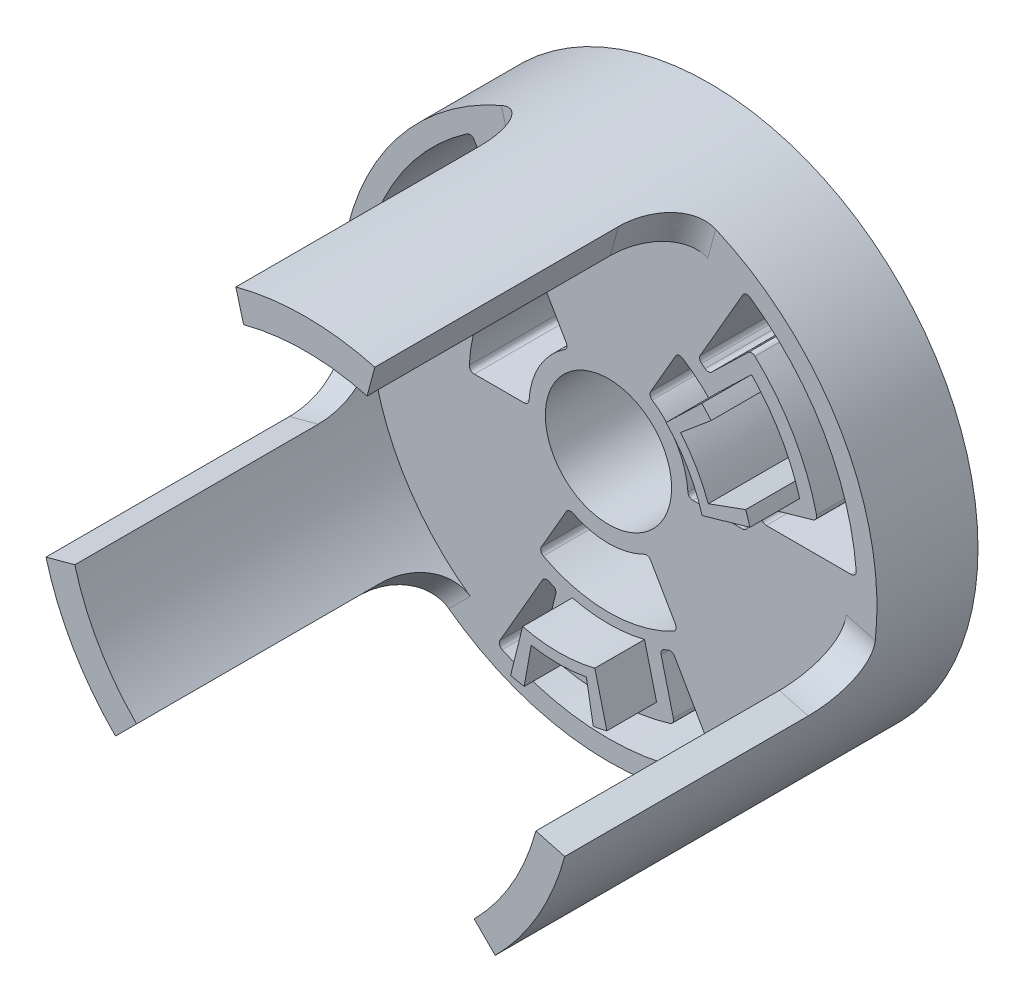
from build123d import *
from build123d.topology import SkipClean

# Parameters (mm, degrees)
SKETCH1_R                = 13.5
BOSS_EXTRUDE1_DEPTH      = 5.08
SKETCH2_R                = 3.175
CUT_EXTRUDE1_DEPTH       = 5.08
CUT_EXTRUDE2_DEPTH       = 5.08
BOSS_EXTRUDE3_DEPTH      = 15.24
BOSS_EXTRUDE4_DEPTH      = 2.5
CUT_EXTRUDE3_REACH       = 26.429
FILLET3_SIZE             = 2
FILLET3_SIZE_2           = 3
CUT_EXTRUDE4_REACH       = 26.429
FILLET4_R                = 0.25
CIRPATTERN1_COUNT        = 3
FILLET4_OF_CIRPATTERN1_R = 0.25


with BuildPart() as part:
    # Sketch1 → Boss-Extrude1 (new body)
    with BuildSketch(Plane.XY):
        Circle(SKETCH1_R)
    extrude(amount=BOSS_EXTRUDE1_DEPTH)

    # Sketch2 → Cut-Extrude1 (cut)
    with BuildSketch(Plane.XY.offset(5.08)):
        Circle(SKETCH2_R)
    extrude(amount=-CUT_EXTRUDE1_DEPTH, mode=Mode.SUBTRACT)

    # Sketch3 → Cut-Extrude2 (cut)
    with BuildSketch(Plane.XY.offset(5.08)):
        with BuildLine():
            ThreePointArc((-4, 0), (-3.464101615, 2), (-2, 3.464101615))
            Line((-2, 3.464101615), (-3.5, 6.062177826))
            ThreePointArc((-3.5, 6.062177826), (-6.062177826, 3.5), (-7, 0))
            Line((-7, 0), (-4, 0))
        make_face()
        with BuildLine():
            Line((3.5, 6.062177826), (2, 3.464101615))
            ThreePointArc((2, 3.464101615), (3.464101615, 2), (4, 0))
            Line((4, 0), (7, 0))
            ThreePointArc((7, 0), (6.062177826, 3.5), (3.5, 6.062177826))
        make_face()
        with BuildLine():
            ThreePointArc((2, -3.464101615), (0, -4), (-2, -3.464101615))
            Line((-2, -3.464101615), (-3.5, -6.062177826))
            ThreePointArc((-3.5, -6.062177826), (0, -7), (3.5, -6.062177826))
            Line((3.5, -6.062177826), (2, -3.464101615))
        make_face()
    extrude(amount=-CUT_EXTRUDE2_DEPTH, mode=Mode.SUBTRACT)

    # Sketch5 → Boss-Extrude3 (add)
    with SkipClean():  # the faces are left unmerged after this step: merging them gives an invalid solid
        with BuildSketch(Plane.XY.offset(5.08)):
            with BuildLine():
                Line((8.485281374, -8.485281374), (9.545941546, -9.545941546))
                ThreePointArc((9.545941546, -9.545941546), (11.691342951, -6.75), (13.039998655, -3.494057109))
                Line((13.039998655, -3.494057109), (11.591109915, -3.105828541))
                ThreePointArc((11.591109915, -3.105828541), (10.392304845, -6), (8.485281374, -8.485281374))
            make_face()
            with BuildLine():
                Line((-8.485281374, -8.485281374), (-9.545941546, -9.545941546))
                ThreePointArc((-9.545941546, -9.545941546), (-11.691342951, -6.75), (-13.039998655, -3.494057109))
                Line((-13.039998655, -3.494057109), (-11.591109915, -3.105828541))
                ThreePointArc((-11.591109915, -3.105828541), (-10.392304845, -6), (-8.485281374, -8.485281374))
            make_face()
            with BuildLine():
                Line((-3.105828541, 11.591109915), (-3.494057109, 13.039998655))
                ThreePointArc((-3.494057109, 13.039998655), (0, 13.5), (3.494057109, 13.039998655))
                Line((3.494057109, 13.039998655), (3.105828541, 11.591109915))
                ThreePointArc((3.105828541, 11.591109915), (0, 12), (-3.105828541, 11.591109915))
            make_face()
        extrude(amount=BOSS_EXTRUDE3_DEPTH)

    # Sketch8 → Boss-Extrude4 (add)
    with SkipClean():  # the faces are left unmerged after this step: merging them gives an invalid solid
        with BuildSketch(Plane.XY.offset(5.08)):
            with BuildLine():
                Line((5.754718403, 5.557266964), (7.193398003, 6.946583705))
                ThreePointArc((7.193398003, 6.946583705), (7.431448255, 6.691306064), (7.660444431, 6.427876097))
                Line((7.660444431, 6.427876097), (7.27742221, 6.106482292))
                Line((7.27742221, 6.106482292), (6.128355545, 5.142300877))
                ThreePointArc((6.128355545, 5.142300877), (6.92820323, 4), (7.517540966, 2.736161147))
                Line((7.517540966, 2.736161147), (8.927079897, 3.249191362))
                Line((8.927079897, 3.249191362), (9.396926208, 3.420201433))
                ThreePointArc((9.396926208, 3.420201433), (9.510565163, 3.090169944), (9.612616959, 2.756373558))
                Line((9.612616959, 2.756373558), (7.690093568, 2.205098847))
                Line((7.690093568, 2.205098847), (7.20946272, 2.067280169))
                ThreePointArc((7.20946272, 2.067280169), (6.495190528, 3.75), (5.395048503, 5.209937778))
                Line((5.395048503, 5.209937778), (5.754718403, 5.557266964))
            make_face()
            with BuildLine():
                Line((-7.27742221, 6.106482292), (-6.128355545, 5.142300877))
                ThreePointArc((-6.128355545, 5.142300877), (-6.92820323, 4), (-7.517540966, 2.736161147))
                Line((-7.517540966, 2.736161147), (-8.927079897, 3.249191362))
                Line((-8.927079897, 3.249191362), (-9.396926208, 3.420201433))
                ThreePointArc((-9.396926208, 3.420201433), (-9.510565163, 3.090169944), (-9.612616959, 2.756373558))
                Line((-9.612616959, 2.756373558), (-7.690093568, 2.205098847))
                Line((-7.690093568, 2.205098847), (-7.20946272, 2.067280169))
                ThreePointArc((-7.20946272, 2.067280169), (-6.495190528, 3.75), (-5.395048503, 5.209937778))
                Line((-5.395048503, 5.209937778), (-5.754718403, 5.557266964))
                Line((-5.754718403, 5.557266964), (-7.193398003, 6.946583705))
                ThreePointArc((-7.193398003, 6.946583705), (-7.431448255, 6.691306064), (-7.660444431, 6.427876097))
                Line((-7.660444431, 6.427876097), (-7.27742221, 6.106482292))
            make_face()
            with BuildLine():
                Line((-1.389185421, -7.878462024), (-1.649657688, -9.355673654))
                Line((-1.649657688, -9.355673654), (-1.736481777, -9.84807753))
                ThreePointArc((-1.736481777, -9.84807753), (-2.079116908, -9.781476007), (-2.419218956, -9.702957263))
                Line((-2.419218956, -9.702957263), (-1.935375165, -7.76236581))
                Line((-1.935375165, -7.76236581), (-1.814414217, -7.277217947))
                ThreePointArc((-1.814414217, -7.277217947), (0, -7.5), (1.814414217, -7.277217947))
                Line((1.814414217, -7.277217947), (1.935375165, -7.76236581))
                Line((1.935375165, -7.76236581), (2.419218956, -9.702957263))
                ThreePointArc((2.419218956, -9.702957263), (2.079116908, -9.781476007), (1.736481777, -9.84807753))
                Line((1.736481777, -9.84807753), (1.649657688, -9.355673654))
                Line((1.649657688, -9.355673654), (1.389185421, -7.878462024))
                ThreePointArc((1.389185421, -7.878462024), (0, -8), (-1.389185421, -7.878462024))
            make_face()
        extrude(amount=BOSS_EXTRUDE4_DEPTH)

    # Sketch9 → Cut-Extrude3 (cut, up to next)
    with BuildSketch(Plane.XY.offset(5.08), mode=Mode.PRIVATE) as cut_extrude3_sk1:
        with BuildLine():
            Line((1.389185421, -7.878462024), (1.736481777, -9.84807753))
            ThreePointArc((1.736481777, -9.84807753), (0, -10), (-1.736481777, -9.84807753))
            Line((-1.736481777, -9.84807753), (-1.389185421, -7.878462024))
            ThreePointArc((-1.389185421, -7.878462024), (0, -8), (1.389185421, -7.878462024))
        make_face()
    cut_extrude3_tool1 = extrude(cut_extrude3_sk1.sketch, amount=-CUT_EXTRUDE3_REACH, mode=Mode.PRIVATE) & part.part
    # Sketch9 → Cut-Extrude3 (cut, up to next)
    with BuildSketch(Plane.XY.offset(5.08), mode=Mode.PRIVATE) as cut_extrude3_sk2:
        with BuildLine():
            Line((9.396926208, 3.420201433), (7.517540966, 2.736161147))
            ThreePointArc((7.517540966, 2.736161147), (6.92820323, 4), (6.128355545, 5.142300877))
            Line((6.128355545, 5.142300877), (7.660444431, 6.427876097))
            ThreePointArc((7.660444431, 6.427876097), (8.660254038, 5), (9.396926208, 3.420201433))
        make_face()
    cut_extrude3_tool2 = extrude(cut_extrude3_sk2.sketch, amount=-CUT_EXTRUDE3_REACH, mode=Mode.PRIVATE) & part.part
    # Sketch9 → Cut-Extrude3 (cut, up to next)
    with BuildSketch(Plane.XY.offset(5.08), mode=Mode.PRIVATE) as cut_extrude3_sk3:
        with BuildLine():
            Line((-7.517540966, 2.736161147), (-9.396926208, 3.420201433))
            ThreePointArc((-9.396926208, 3.420201433), (-8.660254038, 5), (-7.660444431, 6.427876097))
            Line((-7.660444431, 6.427876097), (-6.128355545, 5.142300877))
            ThreePointArc((-6.128355545, 5.142300877), (-6.92820323, 4), (-7.517540966, 2.736161147))
        make_face()
    cut_extrude3_tool3 = extrude(cut_extrude3_sk3.sketch, amount=-CUT_EXTRUDE3_REACH, mode=Mode.PRIVATE) & part.part
    add(cut_extrude3_tool1.solids().sort_by_distance((0, -8.991226, 5.08))[0], mode=Mode.SUBTRACT)
    add(cut_extrude3_tool2.solids().sort_by_distance((7.78663, 4.495613, 5.08))[0], mode=Mode.SUBTRACT)
    add(cut_extrude3_tool3.solids().sort_by_distance((-7.78663, 4.495613, 5.08))[0], mode=Mode.SUBTRACT)

    # Fillet3
    # an asymmetric fillet: 3, 2 mm, written as the material it adds along each edge
    with BuildSketch(Plane(origin=(-20.284442352, -5.435199947, 5.08), x_dir=(-0.2588190451025188, 0.9659258262890689, 0), z_dir=(0.9659258262890689, 0.2588190451025188, 0))) as fillet3_piece_1_section:
        with BuildLine():
            Bezier((FILLET3_SIZE, 0), (0, 0), (0, FILLET3_SIZE_2), weights=[1, 0.707106781, 1])
            Line((0, FILLET3_SIZE_2), (0, 0))
            Line((0, 0), (FILLET3_SIZE, 0))
        make_face()
    fillet3_piece_1 = extrude(amount=16.5, mode=Mode.PRIVATE)
    fillet3_piece_1 = fillet3_piece_1 & Plane(origin=(0, 0, 5.749671488), x_dir=(1, 0, 0), z_dir=(0, 0, -1)) * Cylinder(13.5, 45, mode=Mode.PRIVATE)
    fillet3_piece_1 = fillet3_piece_1 - Plane(origin=(0, 0, 5.749671488), x_dir=(-0.9659258262890689, -0.25881904510251874, 0), z_dir=(0, 0, -1)) * Cylinder(12, 45, mode=Mode.PRIVATE)
    add(fillet3_piece_1)
    with BuildSketch(Plane(origin=(-3.181980515, -3.181980515, 5.08), x_dir=(0.707106781186547, -0.7071067811865482, 0), z_dir=(-0.7071067811865481, -0.7071067811865469, 0))) as fillet3_piece_2_section:
        with BuildLine():
            Bezier((FILLET3_SIZE, 0), (0, 0), (0, FILLET3_SIZE_2), weights=[1, 0.707106781, 1])
            Line((0, FILLET3_SIZE_2), (0, 0))
            Line((0, 0), (FILLET3_SIZE, 0))
        make_face()
    fillet3_piece_2 = extrude(amount=16.5, mode=Mode.PRIVATE)
    fillet3_piece_2 = fillet3_piece_2 & Plane(origin=(0, 0, 5.749671467), x_dir=(1, 0, 0), z_dir=(0, 0, -1)) * Cylinder(13.5, 46, mode=Mode.PRIVATE)
    fillet3_piece_2 = fillet3_piece_2 - Plane(origin=(0, 0, 5.749671467), x_dir=(-0.9659258262890689, -0.25881904510251874, 0), z_dir=(0, 0, -1)) * Cylinder(12, 46, mode=Mode.PRIVATE)
    add(fillet3_piece_2)
    with BuildSketch(Plane(origin=(3.181980515, -3.181980515, 5.08), x_dir=(-0.7071067811865481, -0.707106781186547, 0), z_dir=(0.707106781186547, -0.7071067811865481, 0))) as fillet3_piece_3_section:
        with BuildLine():
            Bezier((FILLET3_SIZE, 0), (0, 0), (0, -FILLET3_SIZE_2), weights=[1, 0.707106781, 1])
            Line((0, -FILLET3_SIZE_2), (0, 0))
            Line((0, 0), (FILLET3_SIZE, 0))
        make_face()
    fillet3_piece_3 = extrude(amount=16.5, mode=Mode.PRIVATE)
    fillet3_piece_3 = fillet3_piece_3 & Plane(origin=(0, 0, 5.749671497), x_dir=(1, 0, 0), z_dir=(0, 0, -1)) * Cylinder(13.5, 45, mode=Mode.PRIVATE)
    fillet3_piece_3 = fillet3_piece_3 - Plane(origin=(0, 0, 5.749671497), x_dir=(0.9659258262890674, -0.2588190451025241, 0), z_dir=(0, 0, -1)) * Cylinder(12, 45, mode=Mode.PRIVATE)
    add(fillet3_piece_3)
    with BuildSketch(Plane(origin=(20.284442352, -5.435199947, 5.08), x_dir=(0.2588190451025222, 0.965925826289068, 0), z_dir=(-0.965925826289068, 0.2588190451025222, 0))) as fillet3_piece_4_section:
        with BuildLine():
            Bezier((FILLET3_SIZE, 0), (0, 0), (0, -FILLET3_SIZE_2), weights=[1, 0.707106781, 1])
            Line((0, -FILLET3_SIZE_2), (0, 0))
            Line((0, 0), (FILLET3_SIZE, 0))
        make_face()
    fillet3_piece_4 = extrude(amount=16.5, mode=Mode.PRIVATE)
    fillet3_piece_4 = fillet3_piece_4 & Plane(origin=(0, 0, 5.749671462), x_dir=(1, 0, 0), z_dir=(0, 0, -1)) * Cylinder(13.5, 46, mode=Mode.PRIVATE)
    fillet3_piece_4 = fillet3_piece_4 - Plane(origin=(0, 0, 5.749671462), x_dir=(0.9659258262890674, -0.2588190451025241, 0), z_dir=(0, 0, -1)) * Cylinder(12, 46, mode=Mode.PRIVATE)
    add(fillet3_piece_4)
    with BuildSketch(Plane(origin=(5.435199947, 20.284442352, 5.08), x_dir=(0.9659258262890699, -0.2588190451025149, 0), z_dir=(-0.2588190451025149, -0.9659258262890699, 0))) as fillet3_piece_5_section:
        with BuildLine():
            Bezier((FILLET3_SIZE, 0), (0, 0), (0, FILLET3_SIZE_2), weights=[1, 0.707106781, 1])
            Line((0, FILLET3_SIZE_2), (0, 0))
            Line((0, 0), (FILLET3_SIZE, 0))
        make_face()
    fillet3_piece_5 = extrude(amount=16.5, mode=Mode.PRIVATE)
    fillet3_piece_5 = fillet3_piece_5 & Plane(origin=(0, 0, 5.749671489), x_dir=(1, 0, 0), z_dir=(0, 0, -1)) * Cylinder(13.5, 46, mode=Mode.PRIVATE)
    fillet3_piece_5 = fillet3_piece_5 - Plane(origin=(0, 0, 5.749671489), x_dir=(0.25881904510251574, 0.9659258262890696, 0), z_dir=(0, 0, -1)) * Cylinder(12, 46, mode=Mode.PRIVATE)
    add(fillet3_piece_5)
    with BuildSketch(Plane(origin=(-1.164685703, 4.346666218, 5.08), x_dir=(-0.9659258262890665, -0.2588190451025271, 0), z_dir=(-0.2588190451025271, 0.9659258262890666, 0))) as fillet3_piece_6_section:
        with BuildLine():
            Bezier((FILLET3_SIZE, 0), (0, 0), (0, FILLET3_SIZE_2), weights=[1, 0.707106781, 1])
            Line((0, FILLET3_SIZE_2), (0, 0))
            Line((0, 0), (FILLET3_SIZE, 0))
        make_face()
    fillet3_piece_6 = extrude(amount=16.5, mode=Mode.PRIVATE)
    fillet3_piece_6 = fillet3_piece_6 & Plane(origin=(0, 0, 5.749671467), x_dir=(1, 0, 0), z_dir=(0, 0, -1)) * Cylinder(13.5, 45, mode=Mode.PRIVATE)
    fillet3_piece_6 = fillet3_piece_6 - Plane(origin=(0, 0, 5.749671467), x_dir=(0.25881904510251574, 0.9659258262890696, 0), z_dir=(0, 0, -1)) * Cylinder(12, 45, mode=Mode.PRIVATE)
    add(fillet3_piece_6)

    # Sketch10 → Cut-Extrude4 (cut, up to next)
    with BuildSketch(Plane.XY.offset(5.08), mode=Mode.PRIVATE) as cut_extrude4_sk1:
        with BuildLine():
            Line((-4.506331208, 6.305194608), (-6.88825891, 10.430814407))
            ThreePointArc((-6.88825891, 10.430814407), (-10.825317547, 6.25), (-12.477479713, 0.75))
            Line((-12.477479713, 0.75), (-7.71362431, 0.75))
            ThreePointArc((-7.71362431, 0.75), (-7.674577533, 1.078591532), (-7.621539603, 1.405216737))
            Line((-7.621539603, 1.405216737), (-10.515111281, 2.234935064))
            ThreePointArc((-10.515111281, 2.234935064), (-10.333579521, 2.963044767), (-10.101695673, 3.676716541))
            ThreePointArc((-10.101695673, 3.676716541), (-9.309773091, 5.375), (-8.234977764, 6.909966804))
            ThreePointArc((-8.234977764, 6.909966804), (-7.732861801, 7.467619994), (-7.193066182, 7.988885961))
            Line((-7.193066182, 7.988885961), (-5.027723193, 5.897838544))
            ThreePointArc((-5.027723193, 5.897838544), (-4.771376434, 6.10708334), (-4.506331208, 6.305194608))
        make_face()
    cut_extrude4_tool1 = extrude(cut_extrude4_sk1.sketch, amount=-CUT_EXTRUDE4_REACH, mode=Mode.PRIVATE) & part.part
    cut_extrude4 = cut_extrude4_tool1.solids().sort_by_distance((-6.023283, 7.033569, 5.08))[0]
    add(cut_extrude4, mode=Mode.SUBTRACT)

    # Fillet4
    fillet4_edges = [part.edges().sort_by_distance(p)[0] for p in [
        (-3.5, -6.062177826, 2.54),
        (-2, -3.464101615, 2.54),
        (2, -3.464101615, 2.54),
        (3.5, -6.062177826, 2.54),
        (7, 0, 2.54),
        (4, 0, 2.54),
        (2, 3.464101615, 2.54),
        (3.5, 6.062177826, 2.54),
        (-6.88825891, 10.430814407, 2.54),
        (-4.506331208, 6.305194608, 2.54),
        (-5.027723193, 5.897838544, 2.54),
        (-7.193066182, 7.988885961, 2.54),
        (-10.515111281, 2.234935064, 2.54),
        (-7.621539603, 1.405216737, 2.54),
        (-7.71362431, 0.75, 2.54),
        (-12.477479713, 0.75, 2.54),
        (-3.5, 6.062177826, 2.54),
        (-2, 3.464101615, 2.54),
        (-4, 0, 2.54),
        (-7, 0, 2.54),
    ]]
    fillet(fillet4_edges, radius=FILLET4_R)

    # CirPattern1: Cut-Extrude4 ×3 about axis
    cirpattern1_axis = Axis((0, 0, 0), (0, 0, 1))
    for i in range(1, CIRPATTERN1_COUNT):
        add(cut_extrude4.rotate(cirpattern1_axis, i * 360 / CIRPATTERN1_COUNT), mode=Mode.SUBTRACT)

    # Fillet4 of CirPattern1
    fillet4_of_cirpattern1_edges = [part.edges().sort_by_distance(p)[0] for p in [
        (7, 0, 2.54),
        (4, 0, 2.54),
        (2, 3.464101615, 2.54),
        (3.5, 6.062177826, 2.54),
        (-3.5, 6.062177826, 2.54),
        (-2, 3.464101615, 2.54),
        (-4, 0, 2.54),
        (-7, 0, 2.54),
        (-5.589220804, -11.180814407, 2.54),
        (-3.207293102, -7.055194608, 2.54),
        (-2.59381641, -7.303055281, 2.54),
        (-3.3220451, -10.223821025, 2.54),
        (3.3220451, -10.223821025, 2.54),
        (2.59381641, -7.303055281, 2.54),
        (3.207293102, -7.055194608, 2.54),
        (5.589220804, -11.180814407, 2.54),
        (-3.5, -6.062177826, 2.54),
        (-2, -3.464101615, 2.54),
        (2, -3.464101615, 2.54),
        (3.5, -6.062177826, 2.54),
        (-3.5, 6.062177826, 2.54),
        (-2, 3.464101615, 2.54),
        (-4, 0, 2.54),
        (-7, 0, 2.54),
        (-3.5, -6.062177826, 2.54),
        (-2, -3.464101615, 2.54),
        (2, -3.464101615, 2.54),
        (3.5, -6.062177826, 2.54),
        (12.477479713, 0.75, 2.54),
        (7.71362431, 0.75, 2.54),
        (7.621539603, 1.405216737, 2.54),
        (10.515111281, 2.234935064, 2.54),
        (7.193066182, 7.988885961, 2.54),
        (5.027723193, 5.897838544, 2.54),
        (4.506331208, 6.305194608, 2.54),
        (6.88825891, 10.430814407, 2.54),
        (7, 0, 2.54),
        (4, 0, 2.54),
        (2, 3.464101615, 2.54),
        (3.5, 6.062177826, 2.54),
    ]]
    fillet(fillet4_of_cirpattern1_edges, radius=FILLET4_OF_CIRPATTERN1_R)


solid = part.part
